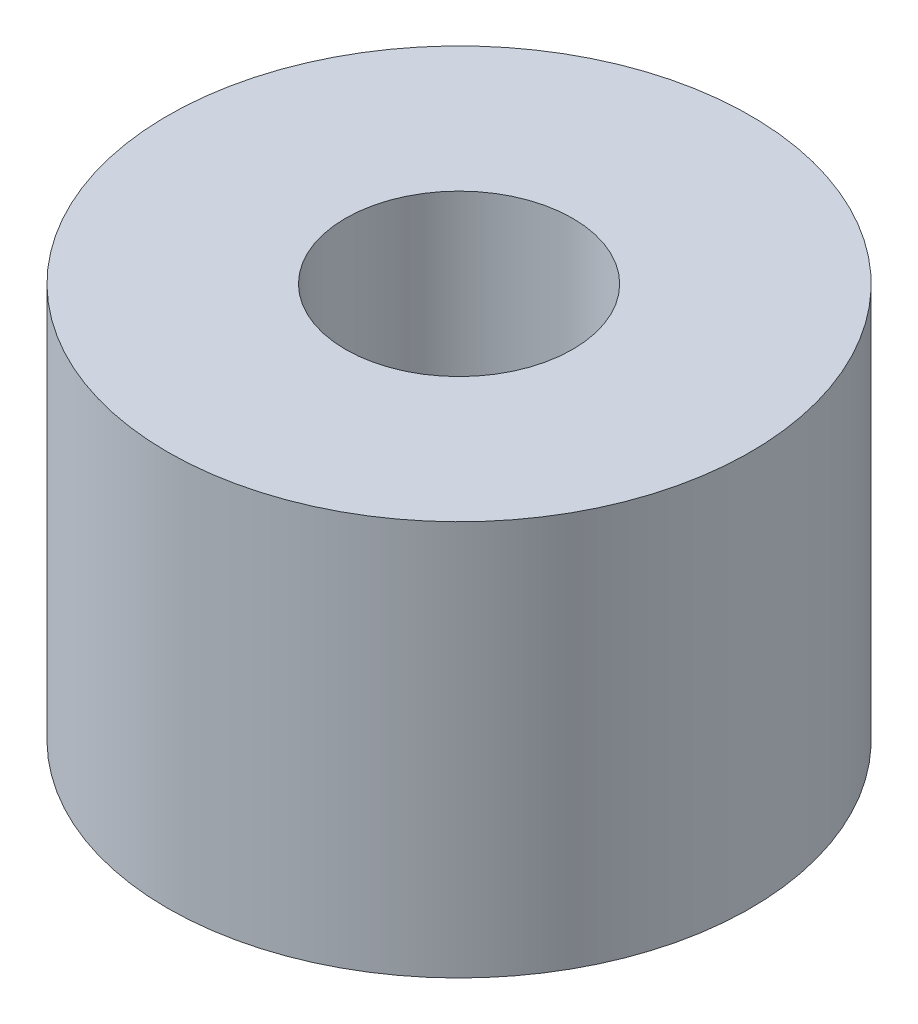
from build123d import *

# Parameters (mm, degrees)
SKETCH1_R           = 2.95
SKETCH1_R_2         = 1.15
BOSS_EXTRUDE1_DEPTH = 4


with BuildPart() as part:
    # Sketch1 → Boss-Extrude1 (new body)
    with BuildSketch(Plane(origin=(0, 0, 0), x_dir=(1, 0, 0), z_dir=(0, 1, 0))):
        Circle(SKETCH1_R)
        Circle(SKETCH1_R_2, mode=Mode.SUBTRACT)
    extrude(amount=BOSS_EXTRUDE1_DEPTH)


solid = part.part
